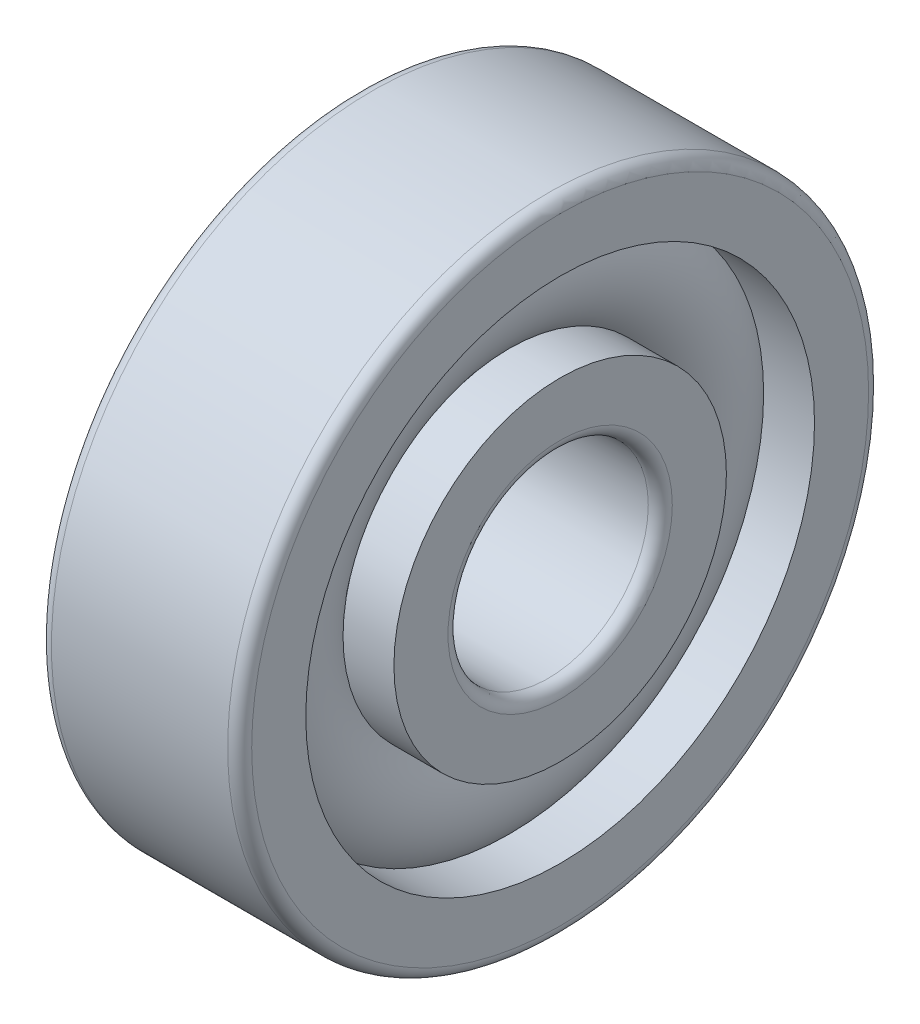
from build123d import *

# Parameters (mm, degrees)
CAGSPISKE_W     = 0.33
CAGSPISKE_H     = 0.55
CAGESPINE_ANGLE = 0.001
BALSIMSKE_R     = 1.65


with BuildPart() as part:
    # CagSpiSke → CageSpine (revolve)
    with BuildSketch(Plane.XY):
        with Locations((0, 5.25)):
            Rectangle(CAGSPISKE_W, CAGSPISKE_H)
    revolve(axis=Axis((-20.6375, 0, 0), (-1, 0, 0)), revolution_arc=CAGESPINE_ANGLE)

    # BalSimSke → BallsSimplified (revolve)
    with BuildSketch(Plane.XY):
        with Locations((0, 5.25)):
            Circle(BALSIMSKE_R)
    revolve(axis=Axis((-10, 0, 0), (1, 0, 0)))

    # InnRacSke → InnerRace (revolve)
    with BuildSketch(Plane.XY):
        with BuildLine():
            Line((-1.196087371, 4.15), (-2.5, 4.15))
            Line((-2.5, 4.15), (-2.5, 2.8))
            ThreePointArc((-2.5, 2.8), (-2.412132034, 2.587867966), (-2.2, 2.5))
            Line((-2.2, 2.5), (2.2, 2.5))
            ThreePointArc((2.2, 2.5), (2.412132034, 2.587867966), (2.5, 2.8))
            Line((2.5, 2.8), (2.5, 4.15))
            Line((2.5, 4.15), (1.196087371, 4.15))
            ThreePointArc((1.196087371, 4.15), (0, 3.625), (-1.196087371, 4.15))
        make_face()
    revolve(axis=Axis((-20.6375, 0, 0), (1, 0, 0)))

    # OutRacSke → OuterRace (revolve)
    with BuildSketch(Plane.XY):
        with BuildLine():
            Line((-1.196087371, 6.35), (-2.5, 6.35))
            Line((-2.5, 6.35), (-2.5, 7.7))
            ThreePointArc((-2.5, 7.7), (-2.412132034, 7.912132034), (-2.2, 8))
            Line((-2.2, 8), (2.2, 8))
            ThreePointArc((2.2, 8), (2.412132034, 7.912132034), (2.5, 7.7))
            Line((2.5, 7.7), (2.5, 6.35))
            Line((2.5, 6.35), (1.196087371, 6.35))
            ThreePointArc((1.196087371, 6.35), (0, 6.875), (-1.196087371, 6.35))
        make_face()
    revolve(axis=Axis((-20.6375, 0, 0), (1, 0, 0)))


solid = part.part
